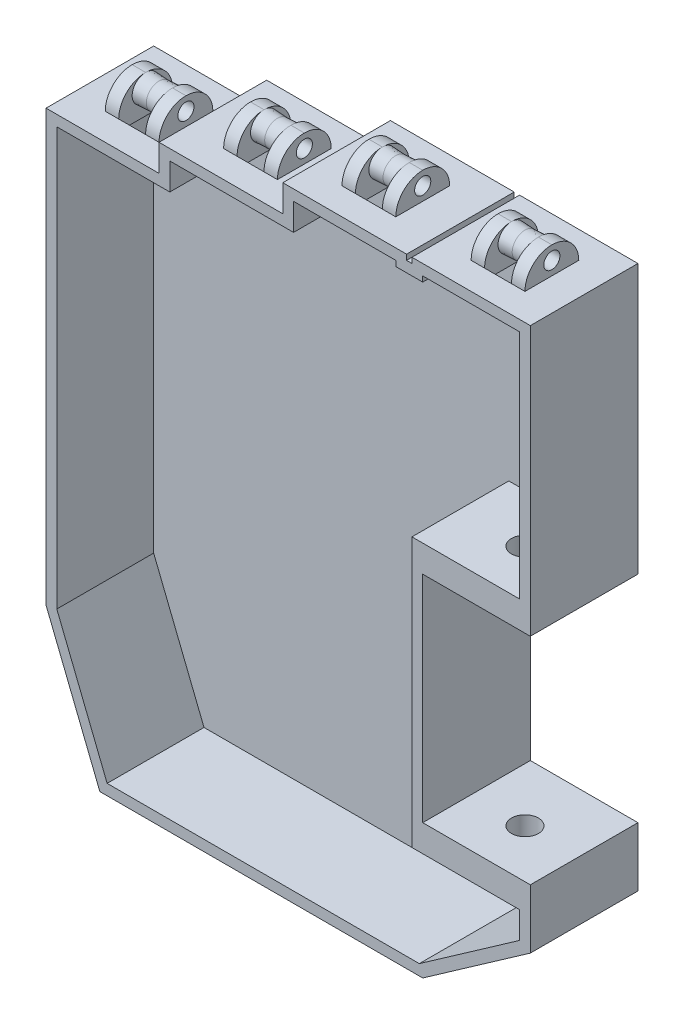
from build123d import *

# Parameters (mm, degrees)
BOSS_EXTRUDE1_DEPTH       = 20
SKETCH2_W                 = 20
SKETCH2_H                 = 40
CUT_EXTRUDE1_DEPTH        = 142.509716981
SHELL1_T                  = -2
SHELL1_THICKNESS_2_FACE_W = 20
SHELL1_THICKNESS_2_FACE_H = 18
SHELL1_THICKNESS_2_DEPTH  = 3
SHELL1_THICKNESS_3_FACE_W = 18
SHELL1_THICKNESS_3_FACE_H = 20
SHELL1_THICKNESS_3_DEPTH  = 3
CUT_EXTRUDE14_REACH       = 110.167
SKETCH34_R                = 2.5
SKETCH3_W                 = 2.5
SKETCH3_H                 = 10
BOSS_EXTRUDE2_DEPTH       = 5
FILLET2_R                 = 5
CUT_EXTRUDE3_REACH        = 149.838
SKETCH6_R                 = 1.5
SKETCH21_R                = 2.5
SKETCH21_R_2              = 1.5
BOSS_EXTRUDE10_DEPTH      = 2.5
BOSS_EXTRUDE10_DRAFT      = 3
MIRROR7_COPY_1_SKETCH_R   = 2.5
MIRROR7_COPY_1_SKETCH_R_2 = 1.5
MIRROR7_COPY_1_DEPTH      = 2.5
MIRROR7_COPY_1_DRAFT      = 3
SKETCH26_W                = 5
SKETCH26_H                = 10
CUT_EXTRUDE8_DEPTH        = 2
SKETCH7_W                 = 2.5
SKETCH7_H                 = 10
BOSS_EXTRUDE4_DEPTH       = 5
FILLET4_R                 = 5
SKETCH22_R                = 2.5
BOSS_EXTRUDE11_DEPTH      = 2.5
BOSS_EXTRUDE11_TAPER      = 3
SKETCH23_R                = 1.5
CUT_EXTRUDE7_DEPTH        = 10
SKETCH27_W                = 5
SKETCH27_H                = 10
CUT_EXTRUDE9_DEPTH        = 2
SKETCH10_W                = 2.5
SKETCH10_H                = 10
BOSS_EXTRUDE6_DEPTH       = 5
FILLET6_R                 = 5
SKETCH28_R                = 2.5
BOSS_EXTRUDE12_DEPTH      = 2.5
BOSS_EXTRUDE12_TAPER      = 3
SKETCH29_R                = 1.5
CUT_EXTRUDE10_DEPTH       = 10
SKETCH30_W                = 5
SKETCH30_H                = 10
CUT_EXTRUDE11_DEPTH       = 2
SKETCH13_W                = 2.5
SKETCH13_H                = 10
BOSS_EXTRUDE8_DEPTH       = 5
FILLET8_R                 = 5
SKETCH31_R                = 2.5
BOSS_EXTRUDE13_DEPTH      = 2.5
BOSS_EXTRUDE13_TAPER      = 3
SKETCH32_R                = 1.5
CUT_EXTRUDE12_DEPTH       = 10
SKETCH33_W                = 5
SKETCH33_H                = 10
CUT_EXTRUDE13_DEPTH       = 2


with BuildPart() as part:
    # Sketch1 → Boss-Extrude1 (new body)
    with BuildSketch(Plane.XY):
        Polygon((58, 114), (58, 115), (80, 115), (80, 20), (60, 0), (0, 0), (-10, 25), (-10, 105), (11, 105), (11, 110), (12, 110), (34, 110), (34, 115), (35, 115), (57, 115), (57, 114), align=None)
        Polygon((80, 14.004150764), (60, 0), (80, 20), align=None)
    extrude(amount=BOSS_EXTRUDE1_DEPTH)

    # Sketch2 → Cut-Extrude1 (cut, through all)
    with BuildSketch(Plane.XY.offset(20)):
        with Locations((70, 45)):
            Rectangle(SKETCH2_W, SKETCH2_H)
    extrude(amount=-CUT_EXTRUDE1_DEPTH, mode=Mode.SUBTRACT)

    # Shell1
    shell1_openings = [part.faces().sort_by_distance(p)[0] for p in [
        (32.82341614, 58.185068385, 20),
    ]]
    offset(amount=SHELL1_T, openings=shell1_openings, kind=Kind.INTERSECTION)

    # Shell1 thickness 2 face (on inner face of the shell) → Shell1 thickness 2 (add)
    with BuildSketch(Plane(origin=(68, 23, 11), x_dir=(1, 0, 0), z_dir=(0, 1, 0))):
        Rectangle(SHELL1_THICKNESS_2_FACE_W, SHELL1_THICKNESS_2_FACE_H)
    extrude(amount=-SHELL1_THICKNESS_2_DEPTH)

    # Shell1 thickness 3 face (on inner face of the shell) → Shell1 thickness 3 (add)
    with BuildSketch(Plane(origin=(68, 67, 11), x_dir=(0, 0, -1), z_dir=(0, -1, 0))):
        Rectangle(SHELL1_THICKNESS_3_FACE_W, SHELL1_THICKNESS_3_FACE_H)
    extrude(amount=-SHELL1_THICKNESS_3_DEPTH)

    # Cut-Extrude14: up to this face of the body (flat: up to its plane)
    cut_extrude14_end = Plane(part.part.faces().sort_by_distance((68, 20, 11))[0])
    # Sketch34 → Cut-Extrude14 (cut, up to the picked face)
    with BuildSketch(Plane(origin=(0, 70, 0), x_dir=(1, 0, 0), z_dir=(0, 1, 0)), mode=Mode.PRIVATE) as cut_extrude14_sk1:
        with Locations(Location((70, -11, 0), (0, 0, 270))):
            Circle(SKETCH34_R)
    cut_extrude14_tool1 = split(extrude(cut_extrude14_sk1.sketch, amount=-CUT_EXTRUDE14_REACH, mode=Mode.PRIVATE), bisect_by=cut_extrude14_end, keep=Keep.BOTH, mode=Mode.PRIVATE)
    add(cut_extrude14_tool1.solids().sort_by(Axis((70, 70, 11), (0, -1, 0)))[0], mode=Mode.SUBTRACT)

    # Sketch3 → Boss-Extrude2 (add)
    with BuildSketch(Plane(origin=(0, 115, 0), x_dir=(1, 0, 0), z_dir=(0, 1, 0))):
        with Locations((65.25, -10)):
            Rectangle(SKETCH3_W, SKETCH3_H)
        with Locations((72.75, -10)):
            Rectangle(SKETCH3_W, SKETCH3_H)
    extrude(amount=BOSS_EXTRUDE2_DEPTH)

    # Fillet2
    fillet2_edges = [part.edges().sort_by_distance(p)[0] for p in [
        (65.25, 120, 5),
        (65.25, 120, 15),
        (72.75, 120, 5),
        (72.75, 120, 15),
    ]]
    fillet(fillet2_edges, radius=FILLET2_R - 0.0001)  # a hair under: the kernel refuses the full size

    # Cut-Extrude3: up to this face of the body (flat: up to its plane)
    cut_extrude3_end = Plane(part.part.faces().sort_by_distance((64, 117.122079053, 10))[0])
    # Sketch6 → Cut-Extrude3 (cut, up to the picked face)
    with BuildSketch(Plane(origin=(74, 0, 0), x_dir=(0, 0, -1), z_dir=(1, 0, 0)), mode=Mode.PRIVATE) as cut_extrude3_sk1:
        with Locations((-10, 117.5)):
            Circle(SKETCH6_R)
    cut_extrude3_tool1 = split(extrude(cut_extrude3_sk1.sketch, amount=-CUT_EXTRUDE3_REACH, mode=Mode.PRIVATE), bisect_by=cut_extrude3_end, keep=Keep.BOTH, mode=Mode.PRIVATE)
    add(cut_extrude3_tool1.solids().sort_by(Axis((74, 117.5, 10), (-1, 0, 0)))[0], mode=Mode.SUBTRACT)


with BuildPart() as boss_extrude10_tool:
    # Sketch21 → Boss-Extrude10 (with draft: the straight prism first)
    with BuildSketch(Plane(origin=(66.5, 0, 0), x_dir=(0, 0, -1), z_dir=(1, 0, 0))):
        with Locations((-10, 117.5)):
            Circle(SKETCH21_R)
        with Locations((-10, 117.5)):
            Circle(SKETCH21_R_2, mode=Mode.SUBTRACT)
    extrude(amount=BOSS_EXTRUDE10_DEPTH)
    # Boss-Extrude10: the draft: its side faces are tilted about the plane it starts from
    boss_extrude10_sides = [boss_extrude10_tool.faces().sort_by_distance(p)[0] for p in [
        (67.75, 117.5, 12.5),
        (67.75, 117.5, 11.5),
    ]]
    draft(boss_extrude10_sides, Plane(origin=(66.5, 0, 0), x_dir=(0, 0, -1), z_dir=(1, 0, 0)), BOSS_EXTRUDE10_DRAFT)


with BuildPart() as part_1:
    add(part.part)

    # Boss-Extrude10: add boss_extrude10_tool
    add(boss_extrude10_tool.part)


with BuildPart() as mirror7_copy_1_tool:
    # Mirror7 copy 1 sketch → Mirror7 copy 1 (with draft: the straight prism first)
    with BuildSketch(Plane(origin=(71.5, 0, 0), x_dir=(0, 0, -1), z_dir=(-1, 0, 0))):
        with Locations((-10, -117.5)):
            Circle(MIRROR7_COPY_1_SKETCH_R)
        with Locations((-10, -117.5)):
            Circle(MIRROR7_COPY_1_SKETCH_R_2, mode=Mode.SUBTRACT)
    extrude(amount=MIRROR7_COPY_1_DEPTH)
    # Mirror7 copy 1: the draft: its side faces are tilted about the plane it starts from
    mirror7_copy_1_sides = [mirror7_copy_1_tool.faces().sort_by_distance(p)[0] for p in [
        (70.25, 117.5, 12.5),
        (70.25, 117.5, 11.5),
    ]]
    draft(mirror7_copy_1_sides, Plane(origin=(71.5, 0, 0), x_dir=(0, 0, -1), z_dir=(-1, 0, 0)), MIRROR7_COPY_1_DRAFT)


with BuildPart() as part_2:
    add(part_1.part)

    # Mirror7 copy 1: add mirror7_copy_1_tool
    add(mirror7_copy_1_tool.part)

    # Sketch26 → Cut-Extrude8 (cut)
    with BuildSketch(Plane(origin=(0, 115, 0), x_dir=(1, 0, 0), z_dir=(0, 1, 0))):
        with Locations((69, -10)):
            Rectangle(SKETCH26_W, SKETCH26_H)
    extrude(amount=-CUT_EXTRUDE8_DEPTH, mode=Mode.SUBTRACT)

    # Sketch7 → Boss-Extrude4 (add)
    with BuildSketch(Plane(origin=(0, 115, 0), x_dir=(1, 0, 0), z_dir=(0, 1, 0))):
        with Locations((41.25, -10)):
            Rectangle(SKETCH7_W, SKETCH7_H)
        with Locations((48.75, -10)):
            Rectangle(SKETCH7_W, SKETCH7_H)
    extrude(amount=BOSS_EXTRUDE4_DEPTH)

    # Fillet4
    fillet4_edges = [part_2.edges().sort_by_distance(p)[0] for p in [
        (41.25, 120, 5),
        (41.25, 120, 15),
        (48.75, 120, 5),
        (48.75, 120, 15),
    ]]
    fillet(fillet4_edges, radius=FILLET4_R - 0.0001)  # a hair under: the kernel refuses the full size

    # Sketch22 → Boss-Extrude11 (add)
    with BuildSketch(Plane(origin=(42.5, 0, 0), x_dir=(0, 0, -1), z_dir=(1, 0, 0))):
        with Locations((-10, 117.5)):
            Circle(SKETCH22_R)
    boss_extrude11 = extrude(amount=BOSS_EXTRUDE11_DEPTH, taper=BOSS_EXTRUDE11_TAPER)

    # Mirror8: Boss-Extrude11 across plane
    add(boss_extrude11.mirror(Plane(origin=(45, 117.5, 10), x_dir=(0, 0, 1), z_dir=(1, 0, 0))))

    # Sketch23 → Cut-Extrude7 (cut)
    with BuildSketch(Plane(origin=(50, 0, 0), x_dir=(0, 0, -1), z_dir=(1, 0, 0))):
        with Locations((-10, 117.5)):
            Circle(SKETCH23_R)
    extrude(amount=-CUT_EXTRUDE7_DEPTH, mode=Mode.SUBTRACT)

    # Sketch27 → Cut-Extrude9 (cut)
    with BuildSketch(Plane(origin=(0, 115, 0), x_dir=(1, 0, 0), z_dir=(0, 1, 0))):
        with Locations((45, -10)):
            Rectangle(SKETCH27_W, SKETCH27_H)
    extrude(amount=-CUT_EXTRUDE9_DEPTH, mode=Mode.SUBTRACT)

    # Sketch10 → Boss-Extrude6 (add)
    with BuildSketch(Plane(origin=(0, 110, 0), x_dir=(1, 0, 0), z_dir=(0, 1, 0))):
        with Locations((19.25, -10)):
            Rectangle(SKETCH10_W, SKETCH10_H)
        with Locations((26.75, -10)):
            Rectangle(SKETCH10_W, SKETCH10_H)
    extrude(amount=BOSS_EXTRUDE6_DEPTH)

    # Fillet6
    fillet6_edges = [part_2.edges().sort_by_distance(p)[0] for p in [
        (19.25, 115, 15),
        (19.25, 115, 5),
        (26.75, 115, 5),
        (26.75, 115, 15),
    ]]
    fillet(fillet6_edges, radius=FILLET6_R - 0.0001)  # a hair under: the kernel refuses the full size

    # Sketch28 → Boss-Extrude12 (add)
    with BuildSketch(Plane(origin=(20.5, 0, 0), x_dir=(0, 0, -1), z_dir=(1, 0, 0))):
        with Locations((-10, 112.5)):
            Circle(SKETCH28_R)
    boss_extrude12 = extrude(amount=BOSS_EXTRUDE12_DEPTH, taper=BOSS_EXTRUDE12_TAPER)

    # Mirror9: Boss-Extrude12 across plane
    add(boss_extrude12.mirror(Plane(origin=(23, 112.5, 10), x_dir=(0, 0, 1), z_dir=(1, 0, 0))))

    # Sketch29 → Cut-Extrude10 (cut)
    with BuildSketch(Plane(origin=(28, 0, 0), x_dir=(0, 0, -1), z_dir=(1, 0, 0))):
        with Locations((-10, 112.5)):
            Circle(SKETCH29_R)
    extrude(amount=-CUT_EXTRUDE10_DEPTH, mode=Mode.SUBTRACT)

    # Sketch30 → Cut-Extrude11 (cut)
    with BuildSketch(Plane(origin=(0, 110, 0), x_dir=(1, 0, 0), z_dir=(0, 1, 0))):
        with Locations((23, -10)):
            Rectangle(SKETCH30_W, SKETCH30_H)
    extrude(amount=-CUT_EXTRUDE11_DEPTH, mode=Mode.SUBTRACT)

    # Sketch13 → Boss-Extrude8 (add)
    with BuildSketch(Plane(origin=(0, 105, 0), x_dir=(1, 0, 0), z_dir=(0, 1, 0))):
        with Locations((-2.75, -10)):
            Rectangle(SKETCH13_W, SKETCH13_H)
        with Locations((4.75, -10)):
            Rectangle(SKETCH13_W, SKETCH13_H)
    extrude(amount=BOSS_EXTRUDE8_DEPTH)

    # Fillet8
    fillet8_edges = [part_2.edges().sort_by_distance(p)[0] for p in [
        (-2.75, 110, 15),
        (-2.75, 110, 5),
        (4.75, 110, 5),
        (4.75, 110, 15),
    ]]
    fillet(fillet8_edges, radius=FILLET8_R - 0.0001)  # a hair under: the kernel refuses the full size

    # Sketch31 → Boss-Extrude13 (add)
    with BuildSketch(Plane(origin=(-1.5, 0, 0), x_dir=(0, 0, -1), z_dir=(1, 0, 0))):
        with Locations((-10, 107.5)):
            Circle(SKETCH31_R)
    boss_extrude13 = extrude(amount=BOSS_EXTRUDE13_DEPTH, taper=BOSS_EXTRUDE13_TAPER)

    # Mirror10: Boss-Extrude13 across plane
    add(boss_extrude13.mirror(Plane(origin=(1, 107.5, 10), x_dir=(0, 0, 1), z_dir=(1, 0, 0))))

    # Sketch32 → Cut-Extrude12 (cut)
    with BuildSketch(Plane(origin=(6, 0, 0), x_dir=(0, 0, -1), z_dir=(1, 0, 0))):
        with Locations((-10, 107.5)):
            Circle(SKETCH32_R)
    extrude(amount=-CUT_EXTRUDE12_DEPTH, mode=Mode.SUBTRACT)

    # Sketch33 → Cut-Extrude13 (cut)
    with BuildSketch(Plane(origin=(0, 105, 0), x_dir=(1, 0, 0), z_dir=(0, 1, 0))):
        with Locations((1, -10)):
            Rectangle(SKETCH33_W, SKETCH33_H)
    extrude(amount=-CUT_EXTRUDE13_DEPTH, mode=Mode.SUBTRACT)


solid = part_2.part
